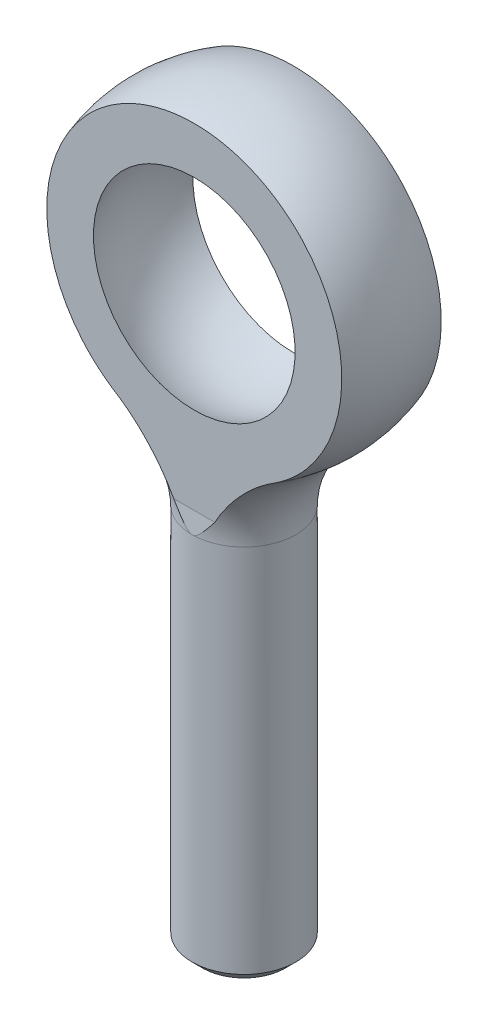
from build123d import *
from OCP.BRepAlgoAPI import BRepAlgoAPI_Cut
from OCP.TopTools import TopTools_ListOfShape

# Parameters (mm, degrees)
CUT_EXTRUDE1_DEPTH      = 41.348741461
CUT_EXTRUDE1_DEPTH_BACK = 41.348741461


with BuildPart() as part:
    # Sketch13 → Revolve4 (revolve)
    with BuildSketch(Plane.XY, mode=Mode.PRIVATE) as revolve4_sk:
        Polygon((3.809238, -34.925), (4.7625, -33.971738), (4.7625, 0), (0, 0), (0, -34.925), align=None)
    revolve(revolve4_sk.sketch.rotate(Axis((0, 0, 0), (0, -1, 0)), 180), axis=Axis((0, 0, 0), (0, -1, 0)))

    # Sketch4 → Revolve2 (revolve)
    with BuildSketch(Plane.XY):
        with BuildLine():
            Line((0, 8.73125), (0, 0))
            Line((0, 0), (4.7625, 0))
            ThreePointArc((4.7625, 0), (5.768081006, 4.259709497), (8.5725, 7.62))
            ThreePointArc((8.5725, 7.62), (13.554312621, 23.568104207), (0, 33.3375))
            Line((0, 33.3375), (0, 29.36875))
            ThreePointArc((0, 29.36875), (10.31875, 19.05), (0, 8.73125))
        make_face()
    revolve(axis=Axis((0, 33.3375, 0), (0, 1, 0)))


with BuildPart() as cut_extrude1_tool:
    # Sketch5 → Cut-Extrude1 (new, two sides: drawn at the far end of the back side and taken through both)
    with BuildSketch(Plane(origin=(0, 0, 0), x_dir=(0, 0, -1), z_dir=(1, 0, 0)).offset(-CUT_EXTRUDE1_DEPTH_BACK)):
        Polygon((4.5640625, 33.3375), (14.2875, 33.3375), (14.2875, 0), (4.7625, 0), (4.5640625, 1.825625), align=None)
        Polygon((-4.5640625, 33.3375), (-4.5640625, 1.825625), (-4.7625, 0), (-14.2875, 0), (-14.2875, 33.3375), align=None)
    extrude(amount=CUT_EXTRUDE1_DEPTH + CUT_EXTRUDE1_DEPTH_BACK)


with BuildPart() as part_1:
    add(part.part)

    # Cut-Extrude1: cut by cut_extrude1_tool, with a tolerance
    cut_extrude1_stock = TopTools_ListOfShape()
    cut_extrude1_stock.Append(part_1.part.wrapped)
    cut_extrude1_tools = TopTools_ListOfShape()
    cut_extrude1_tools.Append(cut_extrude1_tool.part.wrapped)
    cut_extrude1_cut = BRepAlgoAPI_Cut()
    cut_extrude1_cut.SetArguments(cut_extrude1_stock)
    cut_extrude1_cut.SetTools(cut_extrude1_tools)
    cut_extrude1_cut.SetFuzzyValue(0.00001)
    cut_extrude1_cut.Build()
    add(Compound.cast(cut_extrude1_cut.Shape()).solids(), mode=Mode.REPLACE)


solid = part_1.part
